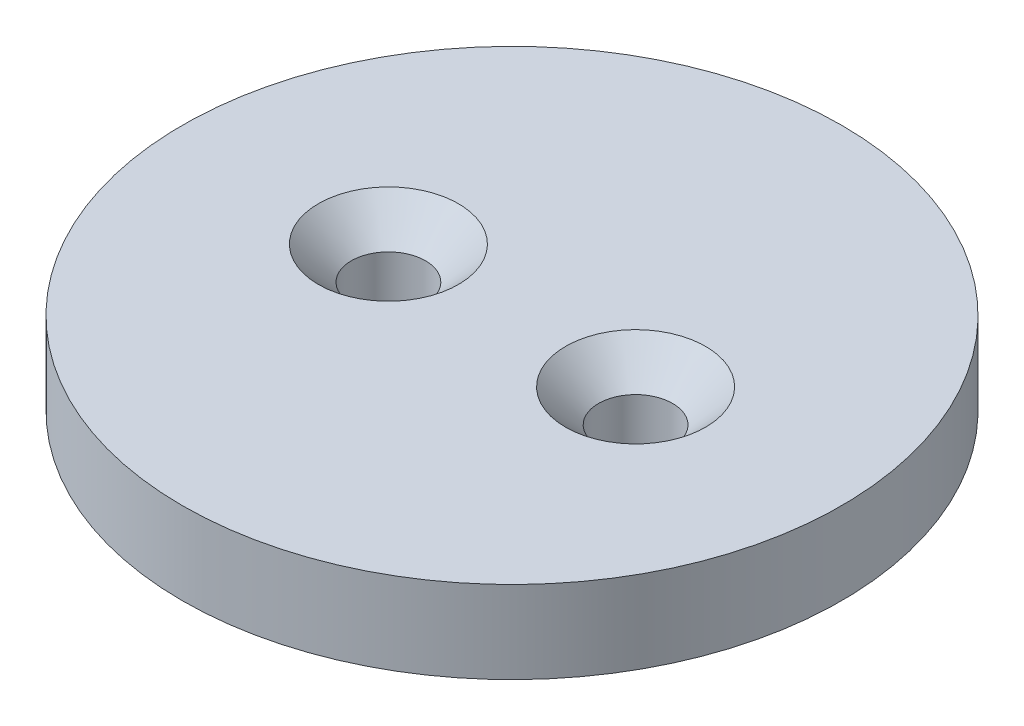
from build123d import *

# Parameters (mm, degrees)
SKETCH1_R           = 20
BOSS_EXTRUDE1_DEPTH = 5
SKETCH2_R           = 2.25
CUT_EXTRUDE1_DEPTH  = 5
CHAMFER1_SIZE       = 2


with BuildPart() as part:
    # Sketch1 → Boss-Extrude1 (new body)
    with BuildSketch(Plane(origin=(0, 0, 0), x_dir=(1, 0, 0), z_dir=(0, 1, 0))):
        Circle(SKETCH1_R)
    extrude(amount=BOSS_EXTRUDE1_DEPTH)

    # Sketch2 → Cut-Extrude1 (cut)
    with BuildSketch(Plane(origin=(0, 5, 0), x_dir=(1, 0, 0), z_dir=(0, 1, 0))):
        with Locations((-7.5, 0)):
            Circle(SKETCH2_R)
        with Locations((7.5, 0)):
            Circle(SKETCH2_R)
    extrude(amount=-CUT_EXTRUDE1_DEPTH, mode=Mode.SUBTRACT)

    # Chamfer1
    chamfer1_edges = [part.edges().sort_by_distance(p)[0] for p in [
        (5.25, 5, 0),
        (-9.75, 5, 0),
    ]]
    chamfer(chamfer1_edges, length=CHAMFER1_SIZE)


solid = part.part
